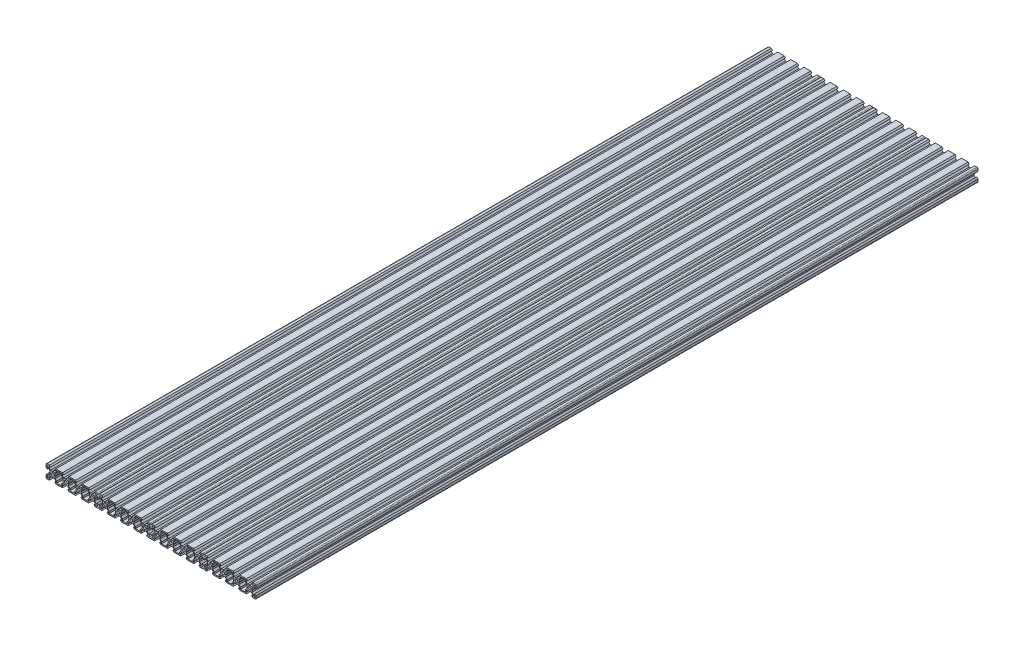
from build123d import *

# Parameters (mm, degrees)
SKETCH1_R               = 2.1
BOSS_EXTRUDE1_DEPTH     = 1100
MIRROR3_COPY_1_SKETCH_R = 2.1
MIRROR3_COPY_1_DEPTH    = 1100


with BuildPart() as part:
    # Sketch1 → Boss-Extrude1 (new body)
    with BuildSketch(Plane.XY):
        with BuildLine():
            Line((4.9, -10), (15.097742088, -10))
            Line((15.097742088, -10), (16.897742088, -8.2))
            Line((16.897742088, -8.2), (14.597742088, -8.2))
            Line((14.597742088, -8.2), (14.597742088, -6.3))
            Line((14.597742088, -6.3), (16.897742088, -4))
            Line((16.897742088, -4), (19.497742088, -4))
            ThreePointArc((19.497742088, -4), (19.997742088, -3.5), (20.497742088, -4))
            Line((20.497742088, -4), (23.097742088, -4))
            Line((23.097742088, -4), (25.397742088, -6.3))
            Line((25.397742088, -6.3), (25.397742088, -8.2))
            Line((25.397742088, -8.2), (23.097742088, -8.2))
            Line((23.097742088, -8.2), (24.897742088, -10))
            Line((24.897742088, -10), (35.1, -10))
            Line((35.1, -10), (36.9, -8.2))
            Line((36.9, -8.2), (34.6, -8.2))
            Line((34.6, -8.2), (34.6, -6.3))
            Line((34.6, -6.3), (36.9, -4))
            Line((36.9, -4), (39.5, -4))
            ThreePointArc((39.5, -4), (40, -3.5), (40.5, -4))
            Line((40.5, -4), (43.1, -4))
            Line((43.1, -4), (45.4, -6.3))
            Line((45.4, -6.3), (45.4, -8.2))
            Line((45.4, -8.2), (43.1, -8.2))
            Line((43.1, -8.2), (44.9, -10))
            Line((44.9, -10), (55.097742088, -10))
            Line((55.097742088, -10), (56.897742088, -8.2))
            Line((56.897742088, -8.2), (54.597742088, -8.2))
            Line((54.597742088, -8.2), (54.597742088, -6.3))
            Line((54.597742088, -6.3), (56.897742088, -4))
            Line((56.897742088, -4), (59.497742088, -4))
            ThreePointArc((59.497742088, -4), (59.997742088, -3.5), (60.497742088, -4))
            Line((60.497742088, -4), (63.097742088, -4))
            Line((63.097742088, -4), (65.397742088, -6.3))
            Line((65.397742088, -6.3), (65.397742088, -8.2))
            Line((65.397742088, -8.2), (63.097742088, -8.2))
            Line((63.097742088, -8.2), (64.897742088, -10))
            Line((64.897742088, -10), (68.498871044, -10))
            ThreePointArc((68.498871044, -10), (69.559531216, -9.560660172), (69.998871044, -8.5))
            Line((69.998871044, -8.5), (69.998871044, -4.88759823))
            Line((69.998871044, -4.88759823), (68.211272814, -3.1))
            Line((68.211272814, -3.1), (68.211272814, -5.4))
            Line((68.211272814, -5.4), (66.311272814, -5.4))
            Line((66.311272814, -5.4), (64.011272814, -3.1))
            Line((64.011272814, -3.1), (64.011272814, -0.5))
            ThreePointArc((64.011272814, -0.5), (63.511272814, 0), (64.011272814, 0.5))
            Line((64.011272814, 0.5), (64.011272814, 3.1))
            Line((64.011272814, 3.1), (66.311272814, 5.4))
            Line((66.311272814, 5.4), (68.211272814, 5.4))
            Line((68.211272814, 5.4), (68.198871044, 3.1))
            Line((68.198871044, 3.1), (69.998871044, 4.9))
            Line((69.998871044, 4.9), (69.998871044, 8.5))
            ThreePointArc((69.998871044, 8.5), (69.559531216, 9.560660172), (68.498871044, 10))
            Line((68.498871044, 10), (64.897742088, 10))
            Line((64.897742088, 10), (63.097742088, 8.2))
            Line((63.097742088, 8.2), (65.397742088, 8.2))
            Line((65.397742088, 8.2), (65.397742088, 6.3))
            Line((65.397742088, 6.3), (63.097742088, 4))
            Line((63.097742088, 4), (60.497742088, 4))
            ThreePointArc((60.497742088, 4), (59.997742088, 3.5), (59.497742088, 4))
            Line((59.497742088, 4), (56.897742088, 4))
            Line((56.897742088, 4), (54.597742088, 6.3))
            Line((54.597742088, 6.3), (54.597742088, 8.2))
            Line((54.597742088, 8.2), (56.897742088, 8.2))
            Line((56.897742088, 8.2), (55.097742088, 10))
            Line((55.097742088, 10), (44.9, 10))
            Line((44.9, 10), (43.1, 8.2))
            Line((43.1, 8.2), (45.4, 8.2))
            Line((45.4, 8.2), (45.4, 6.3))
            Line((45.4, 6.3), (43.1, 4))
            Line((43.1, 4), (40.5, 4))
            ThreePointArc((40.5, 4), (40, 3.5), (39.5, 4))
            Line((39.5, 4), (36.9, 4))
            Line((36.9, 4), (34.6, 6.3))
            Line((34.6, 6.3), (34.6, 8.2))
            Line((34.6, 8.2), (36.9, 8.2))
            Line((36.9, 8.2), (35.1, 10))
            Line((35.1, 10), (24.897742088, 10))
            Line((24.897742088, 10), (23.097742088, 8.2))
            Line((23.097742088, 8.2), (25.397742088, 8.2))
            Line((25.397742088, 8.2), (25.397742088, 6.3))
            Line((25.397742088, 6.3), (23.097742088, 4))
            Line((23.097742088, 4), (20.497742088, 4))
            ThreePointArc((20.497742088, 4), (19.997742088, 3.5), (19.497742088, 4))
            Line((19.497742088, 4), (16.897742088, 4))
            Line((16.897742088, 4), (14.597742088, 6.3))
            Line((14.597742088, 6.3), (14.597742088, 8.2))
            Line((14.597742088, 8.2), (16.897742088, 8.2))
            Line((16.897742088, 8.2), (15.097742088, 10))
            Line((15.097742088, 10), (4.9, 10))
            Line((4.9, 10), (3.1, 8.2))
            Line((3.1, 8.2), (5.4, 8.2))
            Line((5.4, 8.2), (5.4, 6.3))
            Line((5.4, 6.3), (3.1, 4))
            Line((3.1, 4), (0.5, 4))
            ThreePointArc((0.5, 4), (0, 3.5), (-0.5, 4))
            Line((-0.5, 4), (-3.1, 4))
            Line((-3.1, 4), (-5.4, 6.3))
            Line((-5.4, 6.3), (-5.4, 8.2))
            Line((-5.4, 8.2), (-3.1, 8.2))
            Line((-3.1, 8.2), (-4.9, 10))
            Line((-4.9, 10), (-8.501128956, 10))
            ThreePointArc((-8.501128956, 10), (-9.561789128, 9.560660172), (-10.001128956, 8.5))
            Line((-10.001128956, 8.5), (-10.001128956, 4.9))
            Line((-10.001128956, 4.9), (-8.201128956, 3.1))
            Line((-8.201128956, 3.1), (-8.213530726, 5.4))
            Line((-8.213530726, 5.4), (-6.313530726, 5.4))
            Line((-6.313530726, 5.4), (-4.013530726, 3.1))
            Line((-4.013530726, 3.1), (-4.013530726, 0.5))
            ThreePointArc((-4.013530726, 0.5), (-3.513530726, 0), (-4.013530726, -0.5))
            Line((-4.013530726, -0.5), (-4.013530726, -3.1))
            Line((-4.013530726, -3.1), (-6.313530726, -5.4))
            Line((-6.313530726, -5.4), (-8.213530726, -5.4))
            Line((-8.213530726, -5.4), (-8.213530726, -3.1))
            Line((-8.213530726, -3.1), (-10.001128956, -4.88759823))
            Line((-10.001128956, -4.88759823), (-10.001128956, -8.5))
            ThreePointArc((-10.001128956, -8.5), (-9.561789128, -9.560660172), (-8.501128956, -10))
            Line((-8.501128956, -10), (-4.9, -10))
            Line((-4.9, -10), (-3.1, -8.2))
            Line((-3.1, -8.2), (-5.4, -8.2))
            Line((-5.4, -8.2), (-5.4, -6.3))
            Line((-5.4, -6.3), (-3.1, -4))
            Line((-3.1, -4), (-0.5, -4))
            ThreePointArc((-0.5, -4), (0, -3.5), (0.5, -4))
            Line((0.5, -4), (3.1, -4))
            Line((3.1, -4), (5.4, -6.3))
            Line((5.4, -6.3), (5.4, -8.2))
            Line((5.4, -8.2), (3.1, -8.2))
            Line((3.1, -8.2), (4.9, -10))
        make_face()
        Circle(SKETCH1_R, mode=Mode.SUBTRACT)
        with Locations((40, 0)):
            Circle(SKETCH1_R, mode=Mode.SUBTRACT)
        with Locations((19.997742088, 0)):
            Circle(SKETCH1_R, mode=Mode.SUBTRACT)
        with Locations((59.997742088, 0)):
            Circle(SKETCH1_R, mode=Mode.SUBTRACT)
        with BuildLine():
            Line((3.998871044, 0.5), (3.998871044, 3.1))
            Line((3.998871044, 3.1), (6.298871044, 5.4))
            Line((6.298871044, 5.4), (6.298871044, 8.2))
            Line((6.298871044, 8.2), (13.698871044, 8.2))
            Line((13.698871044, 8.2), (13.698871044, 5.4))
            Line((13.698871044, 5.4), (15.998871044, 3.1))
            Line((15.998871044, 3.1), (15.998871044, 0.5))
            ThreePointArc((15.998871044, 0.5), (16.498871044, 0), (15.998871044, -0.5))
            Line((15.998871044, -0.5), (15.998871044, -3.1))
            Line((15.998871044, -3.1), (13.698871044, -5.4))
            Line((13.698871044, -5.4), (13.698871044, -8.2))
            Line((13.698871044, -8.2), (6.298871044, -8.2))
            Line((6.298871044, -8.2), (6.298871044, -5.4))
            Line((6.298871044, -5.4), (3.998871044, -3.1))
            Line((3.998871044, -3.1), (3.998871044, -0.5))
            ThreePointArc((3.998871044, -0.5), (3.498871044, 0), (3.998871044, 0.5))
        make_face(mode=Mode.SUBTRACT)
        with BuildLine():
            Line((26.311272814, -5.4), (26.311272814, -8.2))
            Line((26.311272814, -8.2), (33.686469274, -8.2))
            Line((33.686469274, -8.2), (33.686469274, -5.4))
            Line((33.686469274, -5.4), (35.986469274, -3.1))
            Line((35.986469274, -3.1), (35.986469274, -0.5))
            ThreePointArc((35.986469274, -0.5), (36.486469274, 0), (35.986469274, 0.5))
            Line((35.986469274, 0.5), (35.986469274, 3.1))
            Line((35.986469274, 3.1), (33.686469274, 5.4))
            Line((33.686469274, 5.4), (33.686469274, 8.2))
            Line((33.686469274, 8.2), (26.311272814, 8.2))
            Line((26.311272814, 8.2), (26.311272814, 5.4))
            Line((26.311272814, 5.4), (24.011272814, 3.1))
            Line((24.011272814, 3.1), (24.011272814, 0.5))
            ThreePointArc((24.011272814, 0.5), (23.511272814, 0), (24.011272814, -0.5))
            Line((24.011272814, -0.5), (24.011272814, -3.1))
            Line((24.011272814, -3.1), (26.311272814, -5.4))
        make_face(mode=Mode.SUBTRACT)
        with BuildLine():
            Line((-8.201128956, 7.07322093), (-8.201128956, 7.7))
            ThreePointArc((-8.201128956, 7.7), (-8.054682347, 8.053553391), (-7.701128956, 8.2))
            Line((-7.701128956, 8.2), (-7.07381417, 8.2))
            ThreePointArc((-7.07381417, 8.2), (-6.84282968, 8.045635587), (-6.897091472, 7.773169324))
            Line((-6.897091472, 7.773169324), (-7.774406258, 6.896390254))
            ThreePointArc((-7.774406258, 6.896390254), (-8.046835083, 6.842265659), (-8.201128956, 7.07322093))
        make_face(mode=Mode.SUBTRACT)
        with BuildLine():
            Line((-6.897091472, -7.773169324), (-7.774406258, -6.896390254))
            ThreePointArc((-7.774406258, -6.896390254), (-8.046835083, -6.842265659), (-8.201128956, -7.07322093))
            Line((-8.201128956, -7.07322093), (-8.201128956, -7.7))
            ThreePointArc((-8.201128956, -7.7), (-8.054682347, -8.053553391), (-7.701128956, -8.2))
            Line((-7.701128956, -8.2), (-7.07381417, -8.2))
            ThreePointArc((-7.07381417, -8.2), (-6.84282968, -8.045635587), (-6.897091472, -7.773169324))
        make_face(mode=Mode.SUBTRACT)
        with BuildLine():
            Line((43.998871044, 0.5), (43.998871044, 3.1))
            Line((43.998871044, 3.1), (46.298871044, 5.4))
            Line((46.298871044, 5.4), (46.298871044, 8.2))
            Line((46.298871044, 8.2), (53.698871044, 8.2))
            Line((53.698871044, 8.2), (53.698871044, 5.4))
            Line((53.698871044, 5.4), (55.998871044, 3.1))
            Line((55.998871044, 3.1), (55.998871044, 0.5))
            ThreePointArc((55.998871044, 0.5), (56.498871044, 0), (55.998871044, -0.5))
            Line((55.998871044, -0.5), (55.998871044, -3.1))
            Line((55.998871044, -3.1), (53.698871044, -5.4))
            Line((53.698871044, -5.4), (53.698871044, -8.2))
            Line((53.698871044, -8.2), (46.298871044, -8.2))
            Line((46.298871044, -8.2), (46.298871044, -5.4))
            Line((46.298871044, -5.4), (43.998871044, -3.1))
            Line((43.998871044, -3.1), (43.998871044, -0.5))
            ThreePointArc((43.998871044, -0.5), (43.498871044, 0), (43.998871044, 0.5))
        make_face(mode=Mode.SUBTRACT)
        with BuildLine():
            Line((68.198871044, -7.07322093), (68.198871044, -7.7))
            ThreePointArc((68.198871044, -7.7), (68.052424435, -8.053553391), (67.698871044, -8.2))
            Line((67.698871044, -8.2), (67.071556258, -8.2))
            ThreePointArc((67.071556258, -8.2), (66.840571768, -8.045635587), (66.89483356, -7.773169324))
            Line((66.89483356, -7.773169324), (67.772148346, -6.896390254))
            ThreePointArc((67.772148346, -6.896390254), (68.044577171, -6.842265659), (68.198871044, -7.07322093))
        make_face(mode=Mode.SUBTRACT)
        with BuildLine():
            Line((66.89483356, 7.773169324), (67.772148346, 6.896390254))
            ThreePointArc((67.772148346, 6.896390254), (68.044577171, 6.842265659), (68.198871044, 7.07322093))
            Line((68.198871044, 7.07322093), (68.198871044, 7.7))
            ThreePointArc((68.198871044, 7.7), (68.052424435, 8.053553391), (67.698871044, 8.2))
            Line((67.698871044, 8.2), (67.071556258, 8.2))
            ThreePointArc((67.071556258, 8.2), (66.840571768, 8.045635587), (66.89483356, 7.773169324))
        make_face(mode=Mode.SUBTRACT)
    boss_extrude1 = extrude(amount=BOSS_EXTRUDE1_DEPTH)

    # Mirror1: Boss-Extrude1 across plane
    add(boss_extrude1.mirror(Plane(origin=(-10, 0, 0), x_dir=(0, 0, 1), z_dir=(1, 0, 0))))



with BuildPart() as mirror3_1:
    # Mirror3: Boss-Extrude1 across plane
    add(boss_extrude1.mirror(Plane(origin=(-89.998871044, 0, 1100), x_dir=(0, 0, 1), z_dir=(1, 0, 0))))


with BuildPart() as part_1:
    add(part.part)

    add(mirror3_1.part)  # Mirror3 copy 1 merges Mirror3_1
    # Mirror3 copy 1 sketch → Mirror3 copy 1 (add)
    with BuildSketch(Plane(origin=(-159.997742088, 0, 0), x_dir=(1, 0, 0), z_dir=(0, 0, 1))):
        with BuildLine():
            Line((4.9, -10), (15.097742088, -10))
            Line((15.097742088, -10), (16.897742088, -8.2))
            Line((16.897742088, -8.2), (14.597742088, -8.2))
            Line((14.597742088, -8.2), (14.597742088, -6.3))
            Line((14.597742088, -6.3), (16.897742088, -4))
            Line((16.897742088, -4), (19.497742088, -4))
            ThreePointArc((19.497742088, -4), (19.997742088, -3.5), (20.497742088, -4))
            Line((20.497742088, -4), (23.097742088, -4))
            Line((23.097742088, -4), (25.397742088, -6.3))
            Line((25.397742088, -6.3), (25.397742088, -8.2))
            Line((25.397742088, -8.2), (23.097742088, -8.2))
            Line((23.097742088, -8.2), (24.897742088, -10))
            Line((24.897742088, -10), (35.1, -10))
            Line((35.1, -10), (36.9, -8.2))
            Line((36.9, -8.2), (34.6, -8.2))
            Line((34.6, -8.2), (34.6, -6.3))
            Line((34.6, -6.3), (36.9, -4))
            Line((36.9, -4), (39.5, -4))
            ThreePointArc((39.5, -4), (40, -3.5), (40.5, -4))
            Line((40.5, -4), (43.1, -4))
            Line((43.1, -4), (45.4, -6.3))
            Line((45.4, -6.3), (45.4, -8.2))
            Line((45.4, -8.2), (43.1, -8.2))
            Line((43.1, -8.2), (44.9, -10))
            Line((44.9, -10), (55.097742088, -10))
            Line((55.097742088, -10), (56.897742088, -8.2))
            Line((56.897742088, -8.2), (54.597742088, -8.2))
            Line((54.597742088, -8.2), (54.597742088, -6.3))
            Line((54.597742088, -6.3), (56.897742088, -4))
            Line((56.897742088, -4), (59.497742088, -4))
            ThreePointArc((59.497742088, -4), (59.997742088, -3.5), (60.497742088, -4))
            Line((60.497742088, -4), (63.097742088, -4))
            Line((63.097742088, -4), (65.397742088, -6.3))
            Line((65.397742088, -6.3), (65.397742088, -8.2))
            Line((65.397742088, -8.2), (63.097742088, -8.2))
            Line((63.097742088, -8.2), (64.897742088, -10))
            Line((64.897742088, -10), (68.498871044, -10))
            ThreePointArc((68.498871044, -10), (69.559531216, -9.560660172), (69.998871044, -8.5))
            Line((69.998871044, -8.5), (69.998871044, -4.88759823))
            Line((69.998871044, -4.88759823), (68.211272814, -3.1))
            Line((68.211272814, -3.1), (68.211272814, -5.4))
            Line((68.211272814, -5.4), (66.311272814, -5.4))
            Line((66.311272814, -5.4), (64.011272814, -3.1))
            Line((64.011272814, -3.1), (64.011272814, -0.5))
            ThreePointArc((64.011272814, -0.5), (63.511272814, 0), (64.011272814, 0.5))
            Line((64.011272814, 0.5), (64.011272814, 3.1))
            Line((64.011272814, 3.1), (66.311272814, 5.4))
            Line((66.311272814, 5.4), (68.211272814, 5.4))
            Line((68.211272814, 5.4), (68.198871044, 3.1))
            Line((68.198871044, 3.1), (69.998871044, 4.9))
            Line((69.998871044, 4.9), (69.998871044, 8.5))
            ThreePointArc((69.998871044, 8.5), (69.559531216, 9.560660172), (68.498871044, 10))
            Line((68.498871044, 10), (64.897742088, 10))
            Line((64.897742088, 10), (63.097742088, 8.2))
            Line((63.097742088, 8.2), (65.397742088, 8.2))
            Line((65.397742088, 8.2), (65.397742088, 6.3))
            Line((65.397742088, 6.3), (63.097742088, 4))
            Line((63.097742088, 4), (60.497742088, 4))
            ThreePointArc((60.497742088, 4), (59.997742088, 3.5), (59.497742088, 4))
            Line((59.497742088, 4), (56.897742088, 4))
            Line((56.897742088, 4), (54.597742088, 6.3))
            Line((54.597742088, 6.3), (54.597742088, 8.2))
            Line((54.597742088, 8.2), (56.897742088, 8.2))
            Line((56.897742088, 8.2), (55.097742088, 10))
            Line((55.097742088, 10), (44.9, 10))
            Line((44.9, 10), (43.1, 8.2))
            Line((43.1, 8.2), (45.4, 8.2))
            Line((45.4, 8.2), (45.4, 6.3))
            Line((45.4, 6.3), (43.1, 4))
            Line((43.1, 4), (40.5, 4))
            ThreePointArc((40.5, 4), (40, 3.5), (39.5, 4))
            Line((39.5, 4), (36.9, 4))
            Line((36.9, 4), (34.6, 6.3))
            Line((34.6, 6.3), (34.6, 8.2))
            Line((34.6, 8.2), (36.9, 8.2))
            Line((36.9, 8.2), (35.1, 10))
            Line((35.1, 10), (24.897742088, 10))
            Line((24.897742088, 10), (23.097742088, 8.2))
            Line((23.097742088, 8.2), (25.397742088, 8.2))
            Line((25.397742088, 8.2), (25.397742088, 6.3))
            Line((25.397742088, 6.3), (23.097742088, 4))
            Line((23.097742088, 4), (20.497742088, 4))
            ThreePointArc((20.497742088, 4), (19.997742088, 3.5), (19.497742088, 4))
            Line((19.497742088, 4), (16.897742088, 4))
            Line((16.897742088, 4), (14.597742088, 6.3))
            Line((14.597742088, 6.3), (14.597742088, 8.2))
            Line((14.597742088, 8.2), (16.897742088, 8.2))
            Line((16.897742088, 8.2), (15.097742088, 10))
            Line((15.097742088, 10), (4.9, 10))
            Line((4.9, 10), (3.1, 8.2))
            Line((3.1, 8.2), (5.4, 8.2))
            Line((5.4, 8.2), (5.4, 6.3))
            Line((5.4, 6.3), (3.1, 4))
            Line((3.1, 4), (0.5, 4))
            ThreePointArc((0.5, 4), (0, 3.5), (-0.5, 4))
            Line((-0.5, 4), (-3.1, 4))
            Line((-3.1, 4), (-5.4, 6.3))
            Line((-5.4, 6.3), (-5.4, 8.2))
            Line((-5.4, 8.2), (-3.1, 8.2))
            Line((-3.1, 8.2), (-4.9, 10))
            Line((-4.9, 10), (-8.501128956, 10))
            ThreePointArc((-8.501128956, 10), (-9.561789128, 9.560660172), (-10.001128956, 8.5))
            Line((-10.001128956, 8.5), (-10.001128956, 4.9))
            Line((-10.001128956, 4.9), (-8.201128956, 3.1))
            Line((-8.201128956, 3.1), (-8.213530726, 5.4))
            Line((-8.213530726, 5.4), (-6.313530726, 5.4))
            Line((-6.313530726, 5.4), (-4.013530726, 3.1))
            Line((-4.013530726, 3.1), (-4.013530726, 0.5))
            ThreePointArc((-4.013530726, 0.5), (-3.513530726, 0), (-4.013530726, -0.5))
            Line((-4.013530726, -0.5), (-4.013530726, -3.1))
            Line((-4.013530726, -3.1), (-6.313530726, -5.4))
            Line((-6.313530726, -5.4), (-8.213530726, -5.4))
            Line((-8.213530726, -5.4), (-8.213530726, -3.1))
            Line((-8.213530726, -3.1), (-10.001128956, -4.88759823))
            Line((-10.001128956, -4.88759823), (-10.001128956, -8.5))
            ThreePointArc((-10.001128956, -8.5), (-9.561789128, -9.560660172), (-8.501128956, -10))
            Line((-8.501128956, -10), (-4.9, -10))
            Line((-4.9, -10), (-3.1, -8.2))
            Line((-3.1, -8.2), (-5.4, -8.2))
            Line((-5.4, -8.2), (-5.4, -6.3))
            Line((-5.4, -6.3), (-3.1, -4))
            Line((-3.1, -4), (-0.5, -4))
            ThreePointArc((-0.5, -4), (0, -3.5), (0.5, -4))
            Line((0.5, -4), (3.1, -4))
            Line((3.1, -4), (5.4, -6.3))
            Line((5.4, -6.3), (5.4, -8.2))
            Line((5.4, -8.2), (3.1, -8.2))
            Line((3.1, -8.2), (4.9, -10))
        make_face()
        Circle(MIRROR3_COPY_1_SKETCH_R, mode=Mode.SUBTRACT)
        with Locations((40, 0)):
            Circle(MIRROR3_COPY_1_SKETCH_R, mode=Mode.SUBTRACT)
        with Locations((19.997742088, 0)):
            Circle(MIRROR3_COPY_1_SKETCH_R, mode=Mode.SUBTRACT)
        with Locations((59.997742088, 0)):
            Circle(MIRROR3_COPY_1_SKETCH_R, mode=Mode.SUBTRACT)
        with BuildLine():
            Line((3.998871044, 0.5), (3.998871044, 3.1))
            Line((3.998871044, 3.1), (6.298871044, 5.4))
            Line((6.298871044, 5.4), (6.298871044, 8.2))
            Line((6.298871044, 8.2), (13.698871044, 8.2))
            Line((13.698871044, 8.2), (13.698871044, 5.4))
            Line((13.698871044, 5.4), (15.998871044, 3.1))
            Line((15.998871044, 3.1), (15.998871044, 0.5))
            ThreePointArc((15.998871044, 0.5), (16.498871044, 0), (15.998871044, -0.5))
            Line((15.998871044, -0.5), (15.998871044, -3.1))
            Line((15.998871044, -3.1), (13.698871044, -5.4))
            Line((13.698871044, -5.4), (13.698871044, -8.2))
            Line((13.698871044, -8.2), (6.298871044, -8.2))
            Line((6.298871044, -8.2), (6.298871044, -5.4))
            Line((6.298871044, -5.4), (3.998871044, -3.1))
            Line((3.998871044, -3.1), (3.998871044, -0.5))
            ThreePointArc((3.998871044, -0.5), (3.498871044, 0), (3.998871044, 0.5))
        make_face(mode=Mode.SUBTRACT)
        with BuildLine():
            Line((26.311272814, -5.4), (26.311272814, -8.2))
            Line((26.311272814, -8.2), (33.686469274, -8.2))
            Line((33.686469274, -8.2), (33.686469274, -5.4))
            Line((33.686469274, -5.4), (35.986469274, -3.1))
            Line((35.986469274, -3.1), (35.986469274, -0.5))
            ThreePointArc((35.986469274, -0.5), (36.486469274, 0), (35.986469274, 0.5))
            Line((35.986469274, 0.5), (35.986469274, 3.1))
            Line((35.986469274, 3.1), (33.686469274, 5.4))
            Line((33.686469274, 5.4), (33.686469274, 8.2))
            Line((33.686469274, 8.2), (26.311272814, 8.2))
            Line((26.311272814, 8.2), (26.311272814, 5.4))
            Line((26.311272814, 5.4), (24.011272814, 3.1))
            Line((24.011272814, 3.1), (24.011272814, 0.5))
            ThreePointArc((24.011272814, 0.5), (23.511272814, 0), (24.011272814, -0.5))
            Line((24.011272814, -0.5), (24.011272814, -3.1))
            Line((24.011272814, -3.1), (26.311272814, -5.4))
        make_face(mode=Mode.SUBTRACT)
        with BuildLine():
            Line((-8.201128956, 7.07322093), (-8.201128956, 7.7))
            ThreePointArc((-8.201128956, 7.7), (-8.054682347, 8.053553391), (-7.701128956, 8.2))
            Line((-7.701128956, 8.2), (-7.07381417, 8.2))
            ThreePointArc((-7.07381417, 8.2), (-6.84282968, 8.045635587), (-6.897091472, 7.773169324))
            Line((-6.897091472, 7.773169324), (-7.774406258, 6.896390254))
            ThreePointArc((-7.774406258, 6.896390254), (-8.046835083, 6.842265659), (-8.201128956, 7.07322093))
        make_face(mode=Mode.SUBTRACT)
        with BuildLine():
            Line((-6.897091472, -7.773169324), (-7.774406258, -6.896390254))
            ThreePointArc((-7.774406258, -6.896390254), (-8.046835083, -6.842265659), (-8.201128956, -7.07322093))
            Line((-8.201128956, -7.07322093), (-8.201128956, -7.7))
            ThreePointArc((-8.201128956, -7.7), (-8.054682347, -8.053553391), (-7.701128956, -8.2))
            Line((-7.701128956, -8.2), (-7.07381417, -8.2))
            ThreePointArc((-7.07381417, -8.2), (-6.84282968, -8.045635587), (-6.897091472, -7.773169324))
        make_face(mode=Mode.SUBTRACT)
        with BuildLine():
            Line((43.998871044, 0.5), (43.998871044, 3.1))
            Line((43.998871044, 3.1), (46.298871044, 5.4))
            Line((46.298871044, 5.4), (46.298871044, 8.2))
            Line((46.298871044, 8.2), (53.698871044, 8.2))
            Line((53.698871044, 8.2), (53.698871044, 5.4))
            Line((53.698871044, 5.4), (55.998871044, 3.1))
            Line((55.998871044, 3.1), (55.998871044, 0.5))
            ThreePointArc((55.998871044, 0.5), (56.498871044, 0), (55.998871044, -0.5))
            Line((55.998871044, -0.5), (55.998871044, -3.1))
            Line((55.998871044, -3.1), (53.698871044, -5.4))
            Line((53.698871044, -5.4), (53.698871044, -8.2))
            Line((53.698871044, -8.2), (46.298871044, -8.2))
            Line((46.298871044, -8.2), (46.298871044, -5.4))
            Line((46.298871044, -5.4), (43.998871044, -3.1))
            Line((43.998871044, -3.1), (43.998871044, -0.5))
            ThreePointArc((43.998871044, -0.5), (43.498871044, 0), (43.998871044, 0.5))
        make_face(mode=Mode.SUBTRACT)
        with BuildLine():
            Line((68.198871044, -7.07322093), (68.198871044, -7.7))
            ThreePointArc((68.198871044, -7.7), (68.052424435, -8.053553391), (67.698871044, -8.2))
            Line((67.698871044, -8.2), (67.071556258, -8.2))
            ThreePointArc((67.071556258, -8.2), (66.840571768, -8.045635587), (66.89483356, -7.773169324))
            Line((66.89483356, -7.773169324), (67.772148346, -6.896390254))
            ThreePointArc((67.772148346, -6.896390254), (68.044577171, -6.842265659), (68.198871044, -7.07322093))
        make_face(mode=Mode.SUBTRACT)
        with BuildLine():
            Line((66.89483356, 7.773169324), (67.772148346, 6.896390254))
            ThreePointArc((67.772148346, 6.896390254), (68.044577171, 6.842265659), (68.198871044, 7.07322093))
            Line((68.198871044, 7.07322093), (68.198871044, 7.7))
            ThreePointArc((68.198871044, 7.7), (68.052424435, 8.053553391), (67.698871044, 8.2))
            Line((67.698871044, 8.2), (67.071556258, 8.2))
            ThreePointArc((67.071556258, 8.2), (66.840571768, 8.045635587), (66.89483356, 7.773169324))
        make_face(mode=Mode.SUBTRACT)
    extrude(amount=MIRROR3_COPY_1_DEPTH)


solid = part_1.part
